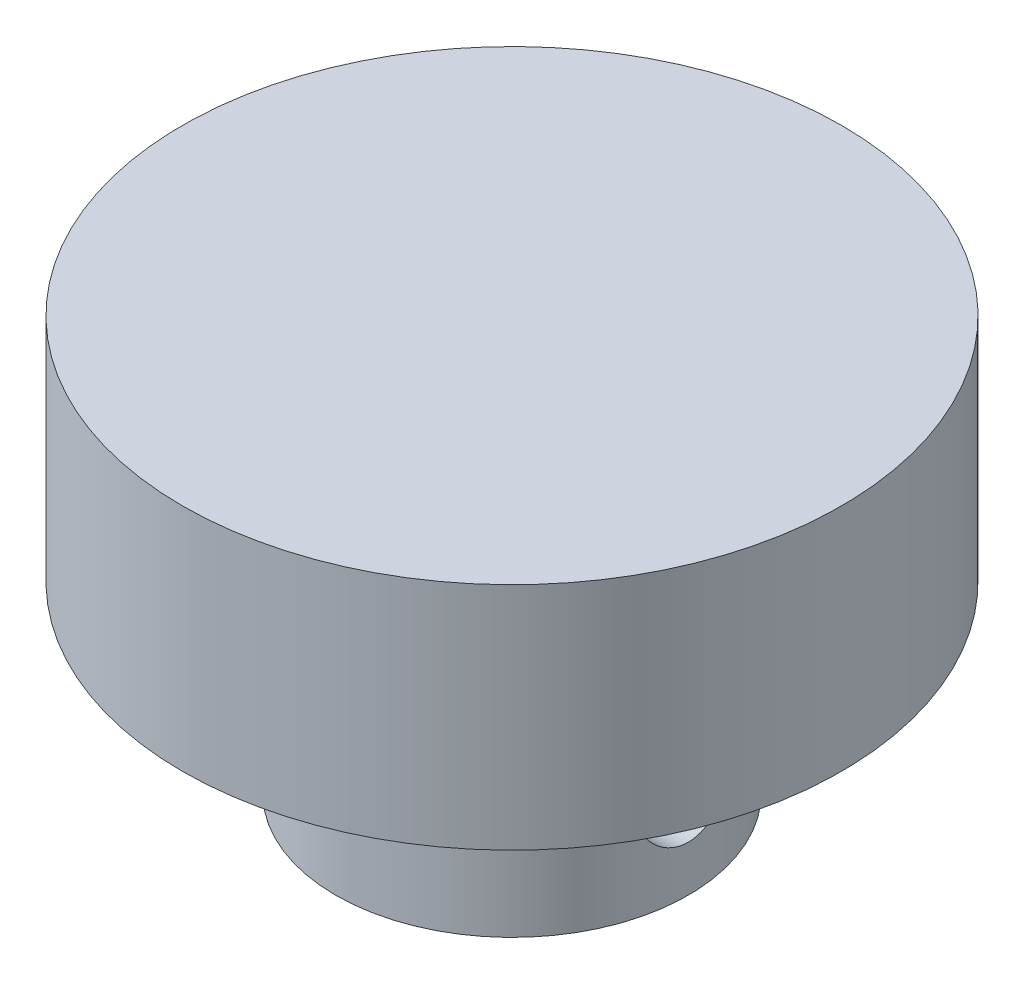
from build123d import *

# Parameters (mm, degrees)
CUT_EXTRUDE2_DEPTH      = 15
CUT_EXTRUDE2_DEPTH_BACK = 13
SKETCH4_R               = 3


with BuildPart() as part:
    # Sketch1 → Revolve1 (revolve)
    with BuildSketch(Plane(origin=(0, 0, 0), x_dir=(0, 0, -1), z_dir=(1, 0, 0))):
        Polygon((2, 0), (21.5, 0), (21.5, -15), (11.5, -15), (11.5, -27), (2, -27), (2, -15), (0, -15), (0, 0), align=None)
    revolve(axis=Axis((0, 0, 0), (0, 1, 0)))

    # Sketch4 → Cut-Extrude2 (cut, two sides: drawn at the far end of the back side and taken through both)
    with BuildSketch(Plane(origin=(0, 0, 0), x_dir=(0, 0, -1), z_dir=(1, 0, 0)).offset(-CUT_EXTRUDE2_DEPTH_BACK)):
        with Locations((0, -21)):
            Circle(SKETCH4_R)
    extrude(amount=CUT_EXTRUDE2_DEPTH + CUT_EXTRUDE2_DEPTH_BACK, mode=Mode.SUBTRACT)


solid = part.part
